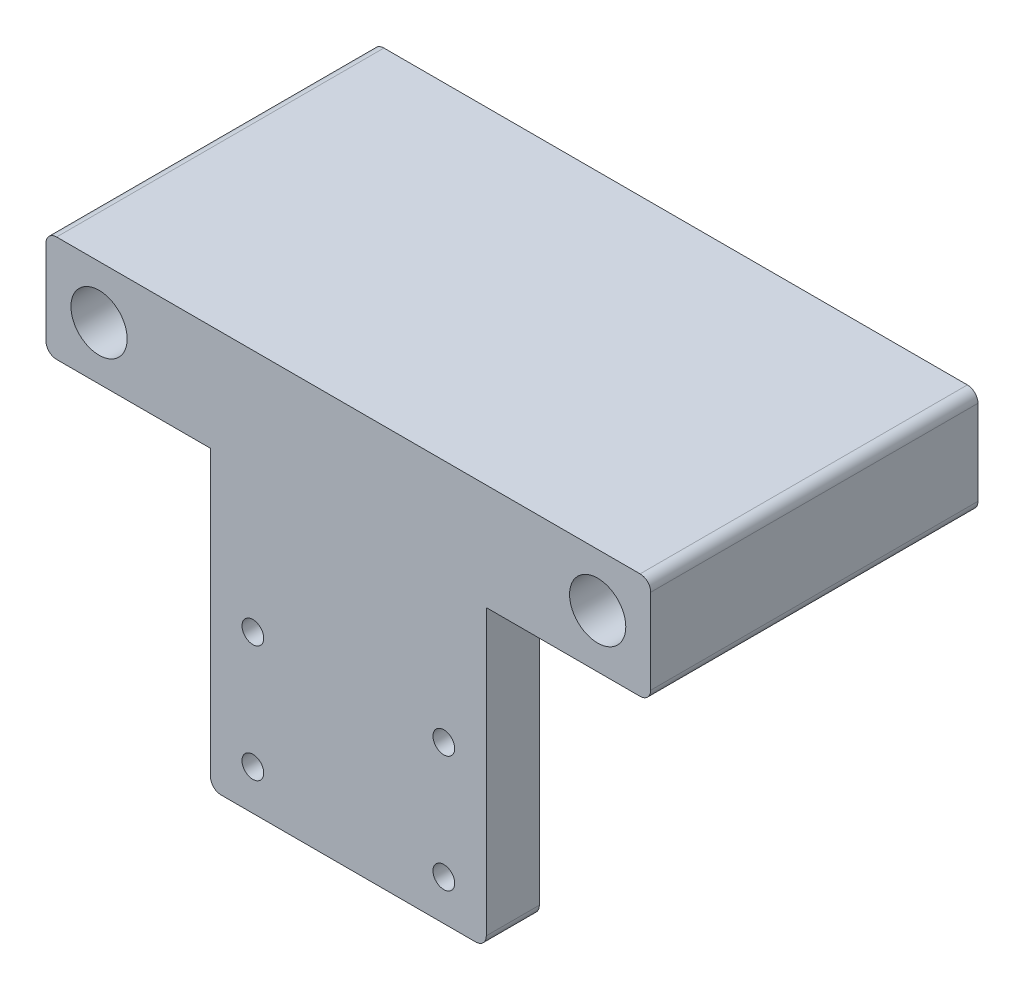
from build123d import *

# Parameters (mm, degrees)
PCB_MOUNT_DEPTH                = 5
STEPPER_OFFSET_MOUNT_DEPTH     = 25.85
M5_CLEARANCE_HOLE1_D           = 5.3
TAP_DRILL_FOR_M2_5X0_45_TAP1_D = 2.05
FILLET1_R                      = 1
FILLET2_R                      = 1


with BuildPart() as part:
    # Body Sketch → PCB Mount (new body)
    with BuildSketch(Plane.XY):
        Polygon((-28.5, 28.5), (-28.5, 18.5), (-13, 18.5), (-13, -9.3), (13, -9.3), (13, 18.5), (28.5, 18.5), (28.5, 28.5), align=None)
    extrude(amount=PCB_MOUNT_DEPTH)

    # Body Sketch<6> → Stepper Offset Mount (add)
    with BuildSketch(Plane.XY):
        Polygon((-28.5, 28.5), (-28.5, 18.5), (-13, 18.5), (13, 18.5), (28.5, 18.5), (28.5, 28.5), align=None)
    extrude(amount=-STEPPER_OFFSET_MOUNT_DEPTH)

    # M5 Clearance Hole1 (through all)
    with Locations(Plane.XY.offset(5)):
        with Locations((-23.5, 23.5), (23.5, 23.5)):
            Hole(M5_CLEARANCE_HOLE1_D / 2)

    # Tap Drill for M2.5x0.45 Tap1 (through all)
    with Locations(Plane.XY.offset(5)):
        with Locations((-9, 5.5), (-9, -5.5), (9, -5.5), (9, 5.5)):
            Hole(TAP_DRILL_FOR_M2_5X0_45_TAP1_D / 2)

    # Fillet1
    fillet1_edges = [part.edges().sort_by_distance(p)[0] for p in [
        (-28.5, 18.5, -10.425),
        (-28.5, 28.5, -10.425),
        (28.5, 18.5, -10.425),
        (28.5, 28.5, -10.425),
    ]]
    fillet(fillet1_edges, radius=FILLET1_R)

    # Fillet2
    fillet2_edges = [part.edges().sort_by_distance(p)[0] for p in [
        (13, -9.3, 2.5),
        (-13, -9.3, 2.5),
    ]]
    fillet(fillet2_edges, radius=FILLET2_R)


solid = part.part
